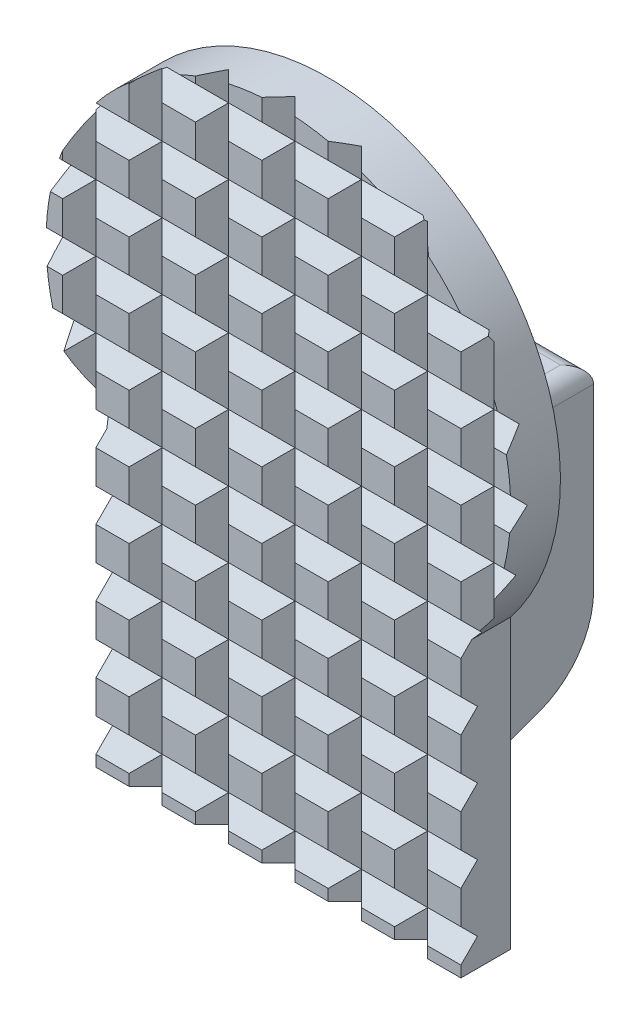
from build123d import *

# Parameters (mm, degrees)
EXTRUDE_1_DEPTH          = 3
EXTRUDE_2_DEPTH          = 3
EXTRUDE_2_DEPTH_BACK     = 3
FILLET_1_R               = 1
FILLET_2_R               = 2
CUT_EXTRUDE_1_DEPTH      = 33.26453161
CUT_EXTRUDE_1_DEPTH_BACK = 33.26453161
CUT_EXTRUDE_2_DEPTH      = 33.26453161
CUT_EXTRUDE_2_DEPTH_BACK = 33.26453161


with BuildPart() as part:
    # Эскиз1 → Бобышка-Вытянуть1 (new body)
    with BuildSketch(Plane.XY):
        with BuildLine():
            Line((-11, -8.660254038), (-11, -26))
            Line((-11, -26), (11, -26))
            Line((11, -26), (11, -8.660254038))
            ThreePointArc((11, -8.660254038), (0, 14), (-11, -8.660254038))
        make_face()
    extrude(amount=EXTRUDE_1_DEPTH)

    # Эскиз2 → Бобышка-Вытянуть2 (add, two sides: drawn at the far end of the back side and taken through both)
    with BuildSketch(Plane(origin=(0, 0, 0), x_dir=(0, 0, -1), z_dir=(1, 0, 0)).offset(-EXTRUDE_2_DEPTH_BACK)):
        with BuildLine():
            Line((0, -26), (9.710100717, -22.465812367))
            ThreePointArc((9.710100717, -22.465812367), (12.095760221, -20.635231445), (13, -17.767349263))
            Line((13, -17.767349263), (13, -6))
            Line((13, -6), (10, -6))
            Line((10, -6), (9.5, -13.007423207))
            ThreePointArc((9.5, -13.007423207), (8.503721286, -15.663470957), (6.222780413, -17.35002652))
            Line((6.222780413, -17.35002652), (0, -19.614933365))
            Line((0, -19.614933365), (0, -26))
        make_face()
    extrude(amount=EXTRUDE_2_DEPTH + EXTRUDE_2_DEPTH_BACK)

    # Скругление1
    fillet_1_edges = [part.edges().sort_by_distance(p)[0] for p in [
        (0, -6, -10),
        (-3, -6, -11.5),
        (0, -6, -13),
        (3, -6, -11.5),
    ]]
    fillet(fillet_1_edges, radius=FILLET_1_R)

    # Скругление2
    # the kernel refuses this fillet: 2 mm, written as the material it adds along each edge
    with BuildSketch(Plane(origin=(-3, -14.614933365, 0), x_dir=(-1, 0, 0), z_dir=(0, -1, 0))) as fillet_2_piece_1_section:
        with BuildLine():
            CenterArc((FILLET_2_R, FILLET_2_R), FILLET_2_R, 180, 90)
            Line((0, FILLET_2_R), (0, 0))
            Line((0, 0), (FILLET_2_R, 0))
        make_face()
    fillet_2_piece_1 = extrude(amount=11.385066635, mode=Mode.PRIVATE)
    fillet_2_piece_1 = split(fillet_2_piece_1, bisect_by=Plane(origin=(-3.45274214, -25.46169245, -1.478987839), z_dir=(0, 0.939692620785908, 0.34202014332566993)), keep=Keep.TOP, mode=Mode.PRIVATE)
    fillet_2_piece_1 = split(fillet_2_piece_1, bisect_by=Plane(origin=(-3.45274214, -19.823536725, 0.573133021), z_dir=(0, -0.9396926207859083, -0.34202014332566905)), keep=Keep.TOP, mode=Mode.PRIVATE)
    add(fillet_2_piece_1)
    with BuildSketch(Plane(origin=(3, -19.614933365, 0), x_dir=(0, 1, 0), z_dir=(-1, 0, 0))) as fillet_2_piece_2:
        with BuildLine():
            CenterArc((FILLET_2_R * 1.42814800674, FILLET_2_R), FILLET_2_R, 160, 110)
            Line((FILLET_2_R * 0.488455385956, FILLET_2_R * 1.34202014333), (0, 0))
            Line((0, 0), (FILLET_2_R * 1.42814800674, 0))
        make_face()
    extrude(amount=6)
    with BuildSketch(Plane(origin=(3, -14.614933365, 0), x_dir=(0, 0, -1), z_dir=(0, -1, 0))) as fillet_2_piece_3_section:
        with BuildLine():
            CenterArc((FILLET_2_R, FILLET_2_R), FILLET_2_R, 180, 90)
            Line((0, FILLET_2_R), (0, 0))
            Line((0, 0), (FILLET_2_R, 0))
        make_face()
    fillet_2_piece_3 = extrude(amount=11.385066635, mode=Mode.PRIVATE)
    fillet_2_piece_3 = split(fillet_2_piece_3, bisect_by=Plane(origin=(3.45274214, -25.46169245, -1.478987839), z_dir=(0, 0.939692620785908, 0.34202014332566993)), keep=Keep.TOP, mode=Mode.PRIVATE)
    fillet_2_piece_3 = split(fillet_2_piece_3, bisect_by=Plane(origin=(3.45274214, -19.823536725, 0.573133021), z_dir=(0, -0.9396926207859083, -0.34202014332566905)), keep=Keep.TOP, mode=Mode.PRIVATE)
    add(fillet_2_piece_3)
    with BuildSketch(Plane(origin=(3, -19.614933365, 0), x_dir=(0, 1, 0), z_dir=(-1, 0, 0))) as fillet_2_piece_4a_section:
        with BuildLine():
            CenterArc((FILLET_2_R * 1.42814800674, FILLET_2_R), FILLET_2_R, 160, 110)
            Line((FILLET_2_R * 0.488455385956, FILLET_2_R * 1.34202014333), (0, 0))
            Line((0, 0), (FILLET_2_R * 1.42814800674, 0))
        make_face()
    fillet_2_piece_4a = extrude(amount=13.140740034, mode=Mode.PRIVATE)
    fillet_2_piece_4a = split(fillet_2_piece_4a, bisect_by=Plane(origin=(-3, -18.703832201, -0.637959903), z_dir=(-1, 0, 0)), keep=Keep.TOP, mode=Mode.PRIVATE)
    with BuildSketch(Plane(origin=(-3, -14.614933365, 0), x_dir=(-1, 0, 0), z_dir=(0, -1, 0))) as fillet_2_piece_4b_section:
        with BuildLine():
            CenterArc((FILLET_2_R, FILLET_2_R), FILLET_2_R, 180, 90)
            Line((0, FILLET_2_R), (0, 0))
            Line((0, 0), (FILLET_2_R, 0))
        make_face()
    fillet_2_piece_4b = extrude(amount=11.385066635, mode=Mode.PRIVATE)
    fillet_2_piece_4b = split(fillet_2_piece_4b, bisect_by=Plane(origin=(-3.46105746, -19.17212139, -1.216615902), z_dir=(0, 0.9396926207859083, 0.34202014332566905)), keep=Keep.TOP, mode=Mode.PRIVATE)
    fillet_2_piece_4 = fillet_2_piece_4a & fillet_2_piece_4b
    add(fillet_2_piece_4)
    with BuildSketch(Plane(origin=(3, -14.614933365, 0), x_dir=(0, 0, -1), z_dir=(0, -1, 0))) as fillet_2_piece_5a_section:
        with BuildLine():
            CenterArc((FILLET_2_R, FILLET_2_R), FILLET_2_R, 180, 90)
            Line((0, FILLET_2_R), (0, 0))
            Line((0, 0), (FILLET_2_R, 0))
        make_face()
    fillet_2_piece_5a = extrude(amount=11.385066635, mode=Mode.PRIVATE)
    fillet_2_piece_5a = split(fillet_2_piece_5a, bisect_by=Plane(origin=(3.46105746, -19.17212139, -1.216615902), z_dir=(0, 0.9396926207859083, 0.34202014332566905)), keep=Keep.TOP, mode=Mode.PRIVATE)
    with BuildSketch(Plane(origin=(10.140740034, -19.614933365, 0), x_dir=(0, 1, 0), z_dir=(-1, 0, 0))) as fillet_2_piece_5b_section:
        with BuildLine():
            CenterArc((FILLET_2_R * 1.42814800674, FILLET_2_R), FILLET_2_R, 160, 110)
            Line((FILLET_2_R * 0.488455385956, FILLET_2_R * 1.34202014333), (0, 0))
            Line((0, 0), (FILLET_2_R * 1.42814800674, 0))
        make_face()
    fillet_2_piece_5b = extrude(amount=13.140740034, mode=Mode.PRIVATE)
    fillet_2_piece_5b = split(fillet_2_piece_5b, bisect_by=Plane(origin=(3, -18.703832201, -0.637959903), z_dir=(1, 0, 0)), keep=Keep.TOP, mode=Mode.PRIVATE)
    fillet_2_piece_5 = fillet_2_piece_5a & fillet_2_piece_5b
    add(fillet_2_piece_5)

    # Эскиз3 → Вырез-Вытянуть1 (cut, two sides: drawn at the far end of the back side and taken through both)
    with BuildSketch(Plane(origin=(0, 0, 0), x_dir=(1, 0, 0), z_dir=(0, 1, 0)).offset(-CUT_EXTRUDE_1_DEPTH_BACK)):
        Polygon((0, -2), (-1.16822604, -3.16822604), (1.16822604, -3.16822604), align=None)
        Polygon((2.83177396, -3.16822604), (5.16822604, -3.16822604), (4, -2), align=None)
        Polygon((6.83177396, -3.16822604), (9.16822604, -3.16822604), (8, -2), align=None)
        Polygon((10.83177396, -3.16822604), (13.16822604, -3.16822604), (12, -2), align=None)
        Polygon((-5.16822604, -3.16822604), (-2.83177396, -3.16822604), (-4, -2), align=None)
        Polygon((-9.16822604, -3.16822604), (-6.83177396, -3.16822604), (-8, -2), align=None)
        Polygon((-13.16822604, -3.16822604), (-10.83177396, -3.16822604), (-12, -2), align=None)
    extrude(amount=CUT_EXTRUDE_1_DEPTH + CUT_EXTRUDE_1_DEPTH_BACK, mode=Mode.SUBTRACT)

    # Эскиз4 → Вырез-Вытянуть2 (cut, two sides: drawn at the far end of the back side and taken through both)
    with BuildSketch(Plane(origin=(0, 0, 0), x_dir=(0, 0, -1), z_dir=(1, 0, 0)).offset(-CUT_EXTRUDE_2_DEPTH_BACK)):
        Polygon((-2, -24.322833837), (-3.326202155, -22.996631681), (-3.326202155, -25.649035992), align=None)
        Polygon((-3.326202155, -21.649035992), (-3.326202155, -18.996631681), (-2, -20.322833837), align=None)
        Polygon((-3.326202155, -17.649035992), (-3.326202155, -14.996631681), (-2, -16.322833837), align=None)
        Polygon((-3.326202155, -13.649035992), (-3.326202155, -10.996631681), (-2, -12.322833837), align=None)
        Polygon((-3.326202155, -9.649035992), (-3.326202155, -6.996631681), (-2, -8.322833837), align=None)
        Polygon((-3.326202155, -5.649035992), (-3.326202155, -2.996631681), (-2, -4.322833837), align=None)
        Polygon((-3.326202155, -1.649035992), (-3.326202155, 1.003368319), (-2, -0.322833837), align=None)
        Polygon((-3.326202155, 2.350964008), (-3.326202155, 5.003368319), (-2, 3.677166163), align=None)
        Polygon((-3.326202155, 6.350964008), (-3.326202155, 9.003368319), (-2, 7.677166163), align=None)
        Polygon((-3.326202155, 10.350964008), (-3.326202155, 13.003368319), (-2, 11.677166163), align=None)
    extrude(amount=CUT_EXTRUDE_2_DEPTH + CUT_EXTRUDE_2_DEPTH_BACK, mode=Mode.SUBTRACT)


solid = part.part
